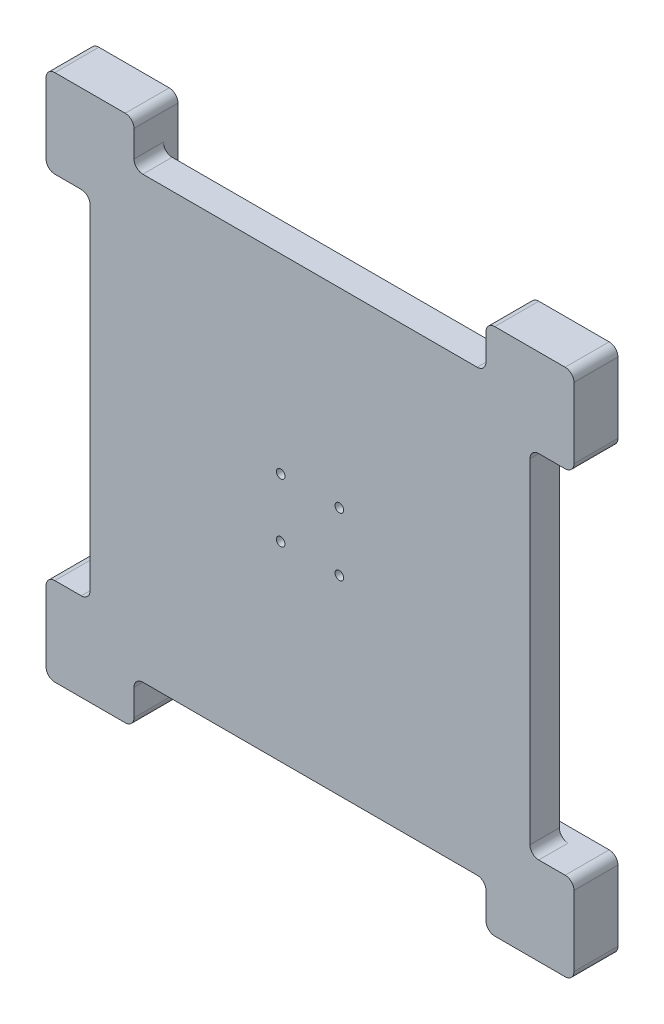
from build123d import *

# Parameters (mm, degrees)
SKETCH1_W               = 150
SKETCH1_H               = 150
BOSS_EXTRUDE1_DEPTH     = 10
SKETCH2_W               = 30
SKETCH2_H               = 30
BOSS_EXTRUDE2_DEPTH     = 15
MIRROR2_COPY_1_SKETCH_W = 30
MIRROR2_COPY_1_SKETCH_H = 30
MIRROR2_COPY_1_DEPTH    = 15
MIRROR2_COPY_2_SKETCH_W = 30
MIRROR2_COPY_2_SKETCH_H = 30
MIRROR2_COPY_2_DEPTH    = 15
FILLET1_R               = 3
SKETCH4_R               = 1.47
CUT_EXTRUDE2_DEPTH      = 10
MIRROR4_COPY_1_SKETCH_R = 1.47
MIRROR4_COPY_1_DEPTH    = 10
MIRROR4_COPY_2_SKETCH_R = 1.47
MIRROR4_COPY_2_DEPTH    = 10


with BuildPart() as part:
    # Sketch1 → Boss-Extrude1 (new body)
    with BuildSketch(Plane.XY):
        Rectangle(SKETCH1_W, SKETCH1_H)
    extrude(amount=BOSS_EXTRUDE1_DEPTH)

    # Sketch2 → Boss-Extrude2 (add)
    with BuildSketch(Plane.XY.offset(10)):
        with Locations((75, -75)):
            Rectangle(SKETCH2_W, SKETCH2_H)
    boss_extrude2 = extrude(amount=-BOSS_EXTRUDE2_DEPTH)

    # Mirror1: Boss-Extrude2 across plane
    add(boss_extrude2.mirror(Plane.ZX))

    # Mirror2 copy 1 sketch → Mirror2 copy 1 (add)
    with BuildSketch(Plane(origin=(0, 0, 10), x_dir=(-1, 0, 0), z_dir=(0, 0, 1))):
        with Locations((75, -75)):
            Rectangle(MIRROR2_COPY_1_SKETCH_W, MIRROR2_COPY_1_SKETCH_H)
    extrude(amount=-MIRROR2_COPY_1_DEPTH)

    # Mirror2 copy 2 sketch → Mirror2 copy 2 (add)
    with BuildSketch(Plane(origin=(0, 0, 10), x_dir=(-1, 0, 0), z_dir=(0, 0, 1))):
        with Locations((75, 75)):
            Rectangle(MIRROR2_COPY_2_SKETCH_W, MIRROR2_COPY_2_SKETCH_H)
    extrude(amount=-MIRROR2_COPY_2_DEPTH)

    # Fillet1
    fillet1_edges = [part.edges().sort_by_distance(p)[0] for p in [
        (-75, 60, 5),
        (-90, 60, 2.5),
        (-90, 90, 2.5),
        (-60, 90, 2.5),
        (-60, 75, 5),
        (60, 75, 5),
        (60, 90, 2.5),
        (90, 90, 2.5),
        (90, 60, 2.5),
        (75, 60, 5),
        (75, -60, 5),
        (90, -60, 2.5),
        (90, -90, 2.5),
        (60, -90, 2.5),
        (60, -75, 5),
        (-60, -90, 2.5),
        (-90, -90, 2.5),
        (-90, -60, 2.5),
        (-75, -60, 5),
        (-60, -75, 5),
    ]]
    fillet(fillet1_edges, radius=FILLET1_R)

    # Sketch4 → Cut-Extrude2 (cut)
    with BuildSketch(Plane.XY.offset(10)):
        with Locations((10, -10)):
            Circle(SKETCH4_R)
    cut_extrude2 = extrude(amount=-CUT_EXTRUDE2_DEPTH, mode=Mode.SUBTRACT)

    # Mirror3: Cut-Extrude2 across plane
    add(cut_extrude2.mirror(Plane(origin=(0, 0, 0), x_dir=(0, 0, 1), z_dir=(1, 0, 0))), mode=Mode.SUBTRACT)

    # Mirror4 copy 1 sketch → Mirror4 copy 1 (cut)
    with BuildSketch(Plane(origin=(0, 0, 10), x_dir=(-1, 0, 0), z_dir=(0, 0, 1))):
        with Locations((10, -10)):
            Circle(MIRROR4_COPY_1_SKETCH_R)
    extrude(amount=-MIRROR4_COPY_1_DEPTH, mode=Mode.SUBTRACT)

    # Mirror4 copy 2 sketch → Mirror4 copy 2 (cut)
    with BuildSketch(Plane.XY.offset(10)):
        with Locations((10, 10)):
            Circle(MIRROR4_COPY_2_SKETCH_R)
    extrude(amount=-MIRROR4_COPY_2_DEPTH, mode=Mode.SUBTRACT)


solid = part.part
